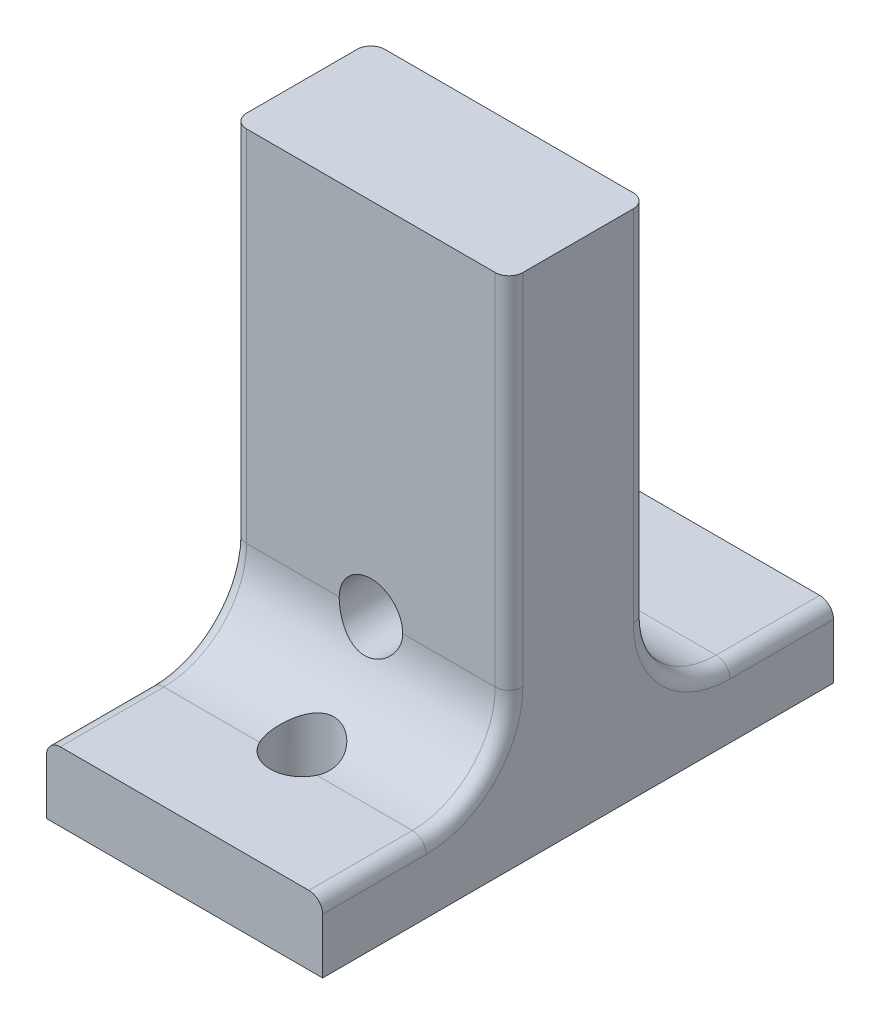
from build123d import *

# Parameters (mm, degrees)
BOSS_EXTRUDE1_DEPTH     = 25.4
FILLET1_R               = 7.62
SKETCH2_R               = 2.921
CUT_EXTRUDE1_DEPTH      = 59.354392508
FILLET2_R               = 1.27
CUT_EXTRUDE2_DEPTH      = 62.187777579
CUT_EXTRUDE2_DEPTH_BACK = 62.187777579
SKETCH3_R               = 2.921


with BuildPart() as part:
    # Sketch1 → Boss-Extrude1 (new body)
    with BuildSketch(Plane(origin=(0, 0, 0), x_dir=(0, 0, -1), z_dir=(1, 0, 0))):
        Polygon((-6.35, 46.99), (6.35, 46.99), (6.35, 6.35), (23.495, 6.35), (23.495, 0), (-23.495, 0), (-23.495, 6.35), (-6.35, 6.35), align=None)
    extrude(amount=BOSS_EXTRUDE1_DEPTH)

    # Fillet1
    fillet1_edges = [part.edges().sort_by_distance(p)[0] for p in [
        (12.7, 6.35, 6.35),
        (12.7, 6.35, -6.35),
    ]]
    fillet(fillet1_edges, radius=FILLET1_R)

    # Sketch2 → Cut-Extrude1 (cut, through all)
    with BuildSketch(Plane.XZ):
        with Locations((12.7, 12.7)):
            Circle(SKETCH2_R)
        with Locations((12.7, -12.7)):
            Circle(SKETCH2_R)
    extrude(amount=-CUT_EXTRUDE1_DEPTH, mode=Mode.SUBTRACT)

    # Fillet2
    fillet2_edges = [part.edges().sort_by_distance(p)[0] for p in [
        (0, 30.48, 6.35),
        (0, 8.581846327, 8.581846327),
        (0, 6.35, 18.7325),
        (25.4, 6.35, 18.7325),
        (25.4, 8.581846327, 8.581846327),
        (25.4, 30.48, 6.35),
        (0, 30.48, -6.35),
        (0, 8.581846327, -8.581846327),
        (0, 6.35, -18.7325),
        (25.4, 6.35, -18.7325),
        (25.4, 8.581846327, -8.581846327),
        (25.4, 30.48, -6.35),
    ]]
    fillet(fillet2_edges, radius=FILLET2_R)

    # Sketch3 → Cut-Extrude2 (cut, two sides: drawn at the far end of the back side and taken through both)
    with BuildSketch(Plane(origin=(0, 0, -6.35), x_dir=(-1, 0, 0), z_dir=(0, 0, -1)).offset(-CUT_EXTRUDE2_DEPTH_BACK)):
        with Locations((-12.7, 13.97)):
            Circle(SKETCH3_R)
    extrude(amount=CUT_EXTRUDE2_DEPTH + CUT_EXTRUDE2_DEPTH_BACK, mode=Mode.SUBTRACT)


solid = part.part
